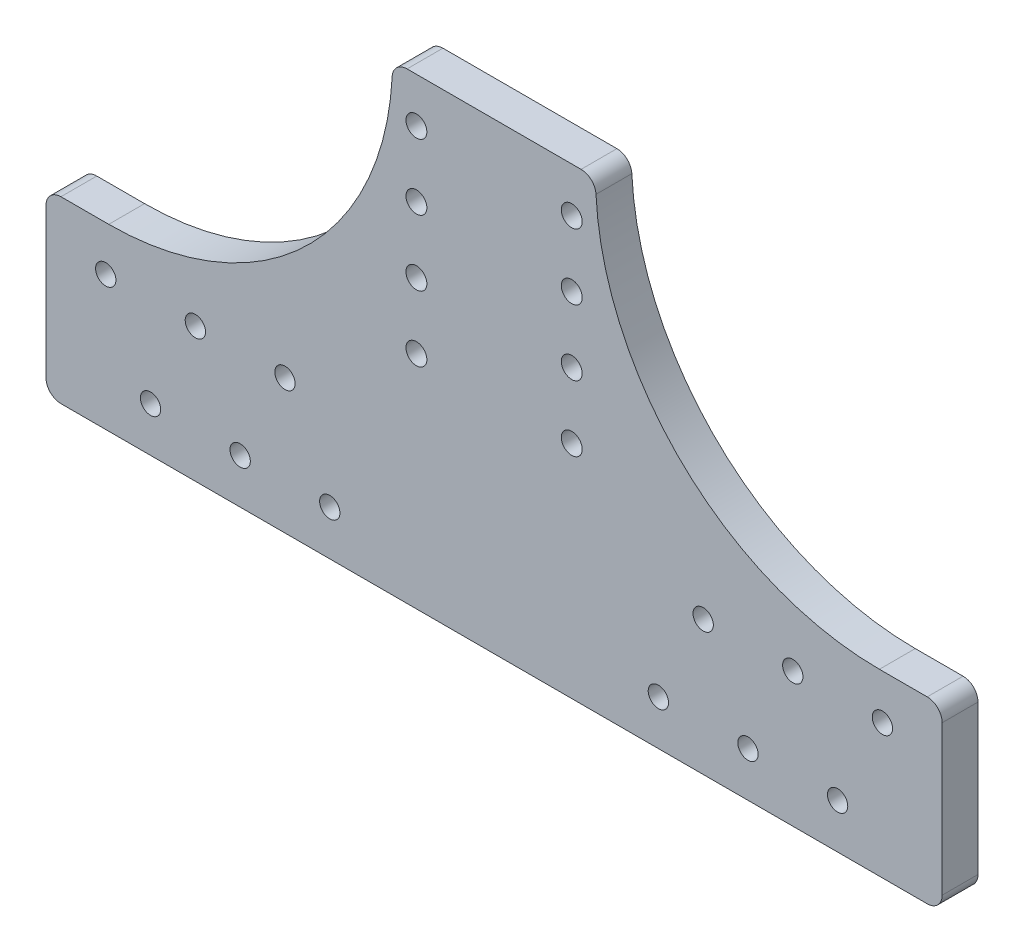
from build123d import *

# Parameters (mm, degrees)
BOSS_EXTRUDE1_DEPTH        = 6
F_7_0_7_DIAMETER_HOLE1_D   = 7
LPATTERN1_COUNT            = 4
LPATTERN1_PITCH            = 22
FILLET1_R                  = 5
MIRROR1_COPY_1_D           = 7
MIRROR1_COPY_2_D           = 7
MIRROR1_COPY_3_D           = 7
FILLET1_OF_MIRROR1_R       = 5
MIRROR5_COPY_1_D           = 7
MIRROR5_COPY_2_D           = 7
MIRROR5_COPY_3_D           = 7
FILLET1_OF_MIRROR5_R       = 5
MIRROR6_START              = -6
MIRROR6_OUTLINE_R          = 3.5
MIRROR6_DEPTH              = 12
F_6_8_6_8_DIAMETER_HOLE1_D = 6.8
SKETCH9_W                  = 314.382892994
SKETCH9_H                  = 141.517755545
CUT_EXTRUDE1_DEPTH         = 196.624640575


# Read off the part's stored shape, not the designer's step: Mirror6
with BuildPart() as part:
    # Sketch1 → Boss-Extrude1 (new, symmetric)
    with BuildSketch(Plane.XY):
        with BuildLine():
            Line((0, 0), (0, 125))
            Line((0, 125), (34, 125))
            ThreePointArc((34, 125), (61.824855787, 57.824855787), (129, 30))
            Line((129, 30), (150, 30))
            Line((150, 30), (150, 0))
            Line((150, 0), (114.303256495, 0))
            Line((114.303256495, 0), (0, 0))
        make_face()
    boss_extrude1 = extrude(amount=BOSS_EXTRUDE1_DEPTH, both=True)

    # Ø7.0 (7) Diameter Hole1 (through all)
    with Locations(Plane.XY.offset(6)):
        with Locations((26, 110)):
            f_7_0_7_diameter_hole1 = Hole(F_7_0_7_DIAMETER_HOLE1_D / 2)

    # LPattern1: Ø7.0 (7) Diameter Hole1 ×4
    with Locations(*[(0, -i * LPATTERN1_PITCH, 0) for i in range(1, LPATTERN1_COUNT)]):
        add(f_7_0_7_diameter_hole1, mode=Mode.SUBTRACT)

    # Fillet1
    fillet1_edges = [part.edges().sort_by_distance(p)[0] for p in [
        (34, 125, 0),
        (150, 30, 0),
    ]]
    fillet(fillet1_edges, radius=FILLET1_R)

    # Mirror1: Boss-Extrude1, Ø7.0 (7) Diameter Hole1 across plane
    add(boss_extrude1.mirror(Plane(origin=(0, 0, 6), x_dir=(0, 0, 1), z_dir=(1, 0, 0))))
    add(f_7_0_7_diameter_hole1.mirror(Plane(origin=(0, 0, 6), x_dir=(0, 0, 1), z_dir=(1, 0, 0))), mode=Mode.SUBTRACT)

    # Mirror1 copy 1 (through all)
    with Locations(Plane(origin=(0, -22, 6), x_dir=(-1, 0, 0), z_dir=(0, 0, 1))):
        with Locations((26, -110)):
            Hole(MIRROR1_COPY_1_D / 2)

    # Mirror1 copy 2 (through all)
    with Locations(Plane(origin=(0, -44, 6), x_dir=(-1, 0, 0), z_dir=(0, 0, 1))):
        with Locations((26, -110)):
            Hole(MIRROR1_COPY_2_D / 2)

    # Mirror1 copy 3 (through all)
    with Locations(Plane(origin=(0, -66, 6), x_dir=(-1, 0, 0), z_dir=(0, 0, 1))):
        with Locations((26, -110)):
            Hole(MIRROR1_COPY_3_D / 2)

    # Fillet1 of Mirror1
    fillet1_of_mirror1_edges = [part.edges().sort_by_distance(p)[0] for p in [
        (-34, 125, 0),
        (-150, 30, 0),
    ]]
    fillet(fillet1_of_mirror1_edges, radius=FILLET1_OF_MIRROR1_R)

    # Mirror5: Boss-Extrude1, Ø7.0 (7) Diameter Hole1 across plane
    add(boss_extrude1.mirror(Plane.ZX))
    add(f_7_0_7_diameter_hole1.mirror(Plane.ZX), mode=Mode.SUBTRACT)

    # Mirror5 copy 1 (through all)
    with Locations(Plane(origin=(0, 22, 6), x_dir=(1, 0, 0), z_dir=(0, 0, 1))):
        with Locations((26, -110)):
            Hole(MIRROR5_COPY_1_D / 2)

    # Mirror5 copy 2 (through all)
    with Locations(Plane(origin=(0, 44, 6), x_dir=(1, 0, 0), z_dir=(0, 0, 1))):
        with Locations((26, -110)):
            Hole(MIRROR5_COPY_2_D / 2)

    # Mirror5 copy 3 (through all)
    with Locations(Plane(origin=(0, 66, 6), x_dir=(1, 0, 0), z_dir=(0, 0, 1))):
        with Locations((26, -110)):
            Hole(MIRROR5_COPY_3_D / 2)

    # Fillet1 of Mirror5
    fillet1_of_mirror5_edges = [part.edges().sort_by_distance(p)[0] for p in [
        (34, -125, 0),
        (150, -30, 0),
    ]]
    fillet(fillet1_of_mirror5_edges, radius=FILLET1_OF_MIRROR5_R)

    # Mirror6 outline → Mirror6 (add)
    with BuildSketch(Plane.XY.offset(MIRROR6_START)):
        with BuildLine():
            Line((0, 0), (-150, 0))
            Line((-150, 0), (-150, -25))
            ThreePointArc((-150, -25), (-148.535533906, -28.535533906), (-145, -30))
            Line((-145, -30), (-129, -30))
            ThreePointArc((-129, -30), (-63.525768428, -56.165960456), (-34.118824312, -120.25))
            ThreePointArc((-34.118824312, -120.25), (-32.571090411, -123.622844187), (-29.125078223, -125))
            Line((-29.125078223, -125), (0, -125))
            Line((0, -125), (0, 0))
        make_face()
        with Locations((-26, -110)):
            Circle(MIRROR6_OUTLINE_R, mode=Mode.SUBTRACT)
        with Locations((-26, -88)):
            Circle(MIRROR6_OUTLINE_R, mode=Mode.SUBTRACT)
        with Locations((-26, -66)):
            Circle(MIRROR6_OUTLINE_R, mode=Mode.SUBTRACT)
        with Locations((-26, -44)):
            Circle(MIRROR6_OUTLINE_R, mode=Mode.SUBTRACT)
    extrude(amount=MIRROR6_DEPTH)

    # Ø6.8 (6.8) Diameter Hole1 (through all)
    with Locations(Plane.XY.offset(6)):
        with Locations((130, 15), (100, 15), (70, 15), (115, -15), (85, -15), (55, -15)):
            f_6_8_6_8_diameter_hole1 = Hole(F_6_8_6_8_DIAMETER_HOLE1_D / 2)

    # Mirror7: Ø6.8 (6.8) Diameter Hole1 across plane
    add(f_6_8_6_8_diameter_hole1.mirror(Plane(origin=(0, 0, 0), x_dir=(0, 0, 1), z_dir=(1, 0, 0))), mode=Mode.SUBTRACT)

    # Sketch9 → Cut-Extrude1 (cut, through all)
    with BuildSketch(Plane.XY.offset(6)):
        with Locations((3.183624233, -100.758877772)):
            Rectangle(SKETCH9_W, SKETCH9_H)
    extrude(amount=-CUT_EXTRUDE1_DEPTH, mode=Mode.SUBTRACT)


solid = part.part
